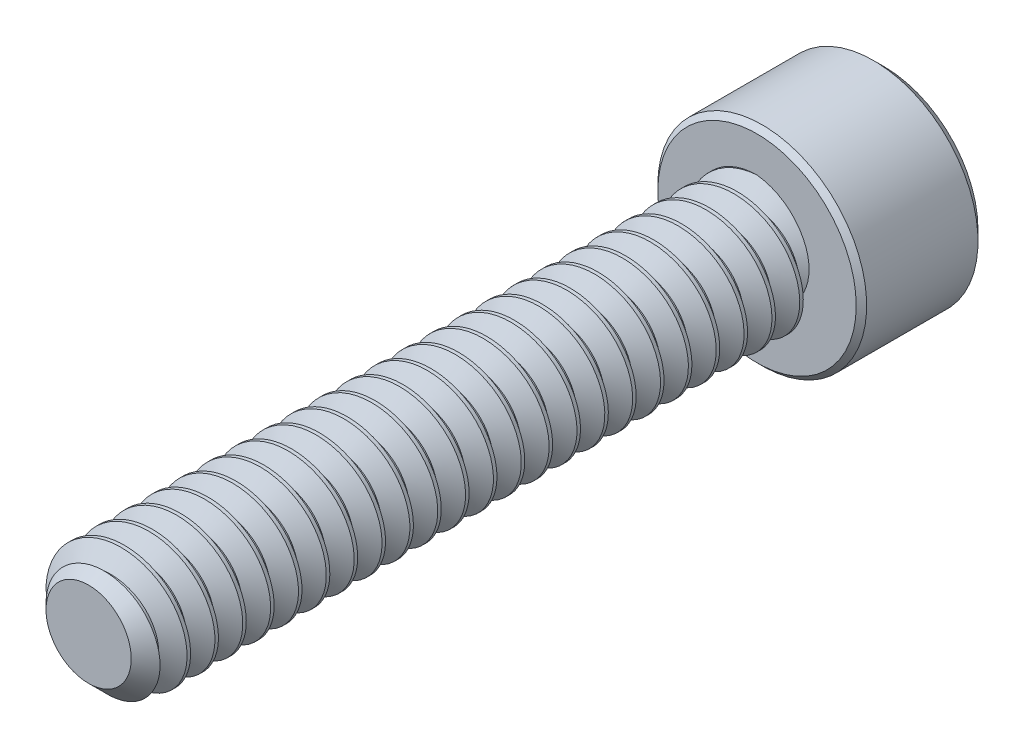
from build123d import *

# Parameters (mm, degrees)
SKETCH1_R          = 2.413
EXTRUDE1_DEPTH     = 25.4
CHAMFER3_SIZE      = 0.79375
CUT_SWEEP1_PITCH   = 1.058333333
SKETCH6_R          = 3.96875
EXTRUDE2_DEPTH     = 4.826
CUT_EXTRUDE1_DEPTH = 2.9765625
CHAMFER1_SIZE      = 0.396875
CHAMFER2_SIZE      = 0.1984375


with BuildPart() as part:
    # Sketch1 → Extrude1 (new body)
    with BuildSketch(Plane.XY):
        Circle(SKETCH1_R)
    extrude(amount=-EXTRUDE1_DEPTH)

    # Chamfer3
    chamfer3_edges = [part.edges().sort_by_distance(p)[0] for p in [
        (-2.413, 0, 0),
    ]]
    chamfer(chamfer3_edges, length=CHAMFER3_SIZE)

    # Cut-Sweep1: the profile of Sketch3 profile screwed along a right-hand helix of 25 turns, 6 arcs to a turn; built about Z, then put on its axis
    cut_sweep1_z = Axis((0, 0, 0), (0, 0, 1))
    cut_sweep1_corners = [(2.4133, 0, -0.926214872), (1.725592336, 0, -0.529166667), (1.725592336, 0, -0.396875), (2.4133, 0, 0.000173205)]
    with BuildLine(mode=Mode.PRIVATE) as cut_sweep1_profile:
        Line(cut_sweep1_corners[0], cut_sweep1_corners[1])
        Line(cut_sweep1_corners[1], cut_sweep1_corners[2])
        Line(cut_sweep1_corners[2], cut_sweep1_corners[3])
        Line(cut_sweep1_corners[3], cut_sweep1_corners[0])
    cut_sweep1_cap = Face(cut_sweep1_profile.wire())
    cut_sweep1_turn_angles = [0, 30, 60, 90, 120, 150, 180, 210, 240, 270, 300, 330, 360]
    cut_sweep1_turn_weights = [1, 0.8660254037844387, 1, 0.8660254037844387, 1, 0.8660254037844387, 1, 0.8660254037844387, 1, 0.8660254037844387, 1, 0.8660254037844387, 1]
    cut_sweep1_turn_rails = [Edge.make_bspline([Vector(p[0], p[1], 0).rotate(cut_sweep1_z, cut_sweep1_turn_angles[k]) / cut_sweep1_turn_weights[k] + Vector(0, 0, p[2] + CUT_SWEEP1_PITCH * cut_sweep1_turn_angles[k] / 360) for k in range(13)], [0, 0, 0, 1, 1, 2, 2, 3, 3, 4, 4, 5, 5, 6, 6, 6], 2, cut_sweep1_turn_weights) for p in cut_sweep1_corners]
    cut_sweep1_turn_sides = [Face.make_surface_from_curves(cut_sweep1_turn_rails[p[0]], cut_sweep1_turn_rails[p[1]]) for p in [(0, 1), (1, 2), (2, 3), (3, 0)]]
    cut_sweep1 = Plane(origin=(0, 0, 0), x_dir=(0, 1, 0), z_dir=(0, 0, -1)) * Solid(Shell([*[p.moved(Location((0, 0, CUT_SWEEP1_PITCH * i))) for i in range(25) for p in cut_sweep1_turn_sides], cut_sweep1_cap, cut_sweep1_cap.rotate(cut_sweep1_z, 9000).moved(Location((0, 0, CUT_SWEEP1_PITCH * 9000 / 360)))]))
    add(cut_sweep1, mode=Mode.SUBTRACT)

    # Sketch6 → Extrude2 (add)
    with BuildSketch(Plane(origin=(0, 0, -25.4), x_dir=(-1, 0, 0), z_dir=(0, 0, -1))):
        Circle(SKETCH6_R)
    extrude(amount=EXTRUDE2_DEPTH)

    # Sketch7 → Cut-Extrude1 (cut)
    with BuildSketch(Plane(origin=(0, 0, -30.226), x_dir=(-1, 0, 0), z_dir=(0, 0, -1))):
        Polygon((0, 2.291358881), (-1.984375, 1.14567944), (-1.984375, -1.14567944), (0, -2.291358881), (1.984375, -1.14567944), (1.984375, 1.14567944), align=None)
    extrude(amount=-CUT_EXTRUDE1_DEPTH, mode=Mode.SUBTRACT)

    # Cut-Extrude2 cone 1 section (through the dimple's axis) → Cut-Extrude2 (revolve, cut)
    with BuildSketch(Plane(origin=(0, 0, -30.226), x_dir=(0, 1, 0), z_dir=(1, 0, 0))):
        Polygon((0, 0), (2.291358881, 0), (0, 2.291358881), align=None)
    revolve(axis=Axis((0, 0, -30.226), (0, 0, 1)), mode=Mode.SUBTRACT)

    # Chamfer1
    chamfer1_edges = [part.edges().sort_by_distance(p)[0] for p in [
        (3.96875, 0, -30.226),
    ]]
    chamfer(chamfer1_edges, length=CHAMFER1_SIZE)

    # Chamfer2
    chamfer2_edges = [part.edges().sort_by_distance(p)[0] for p in [
        (3.96875, 0, -25.4),
    ]]
    chamfer(chamfer2_edges, length=CHAMFER2_SIZE)


solid = part.part
